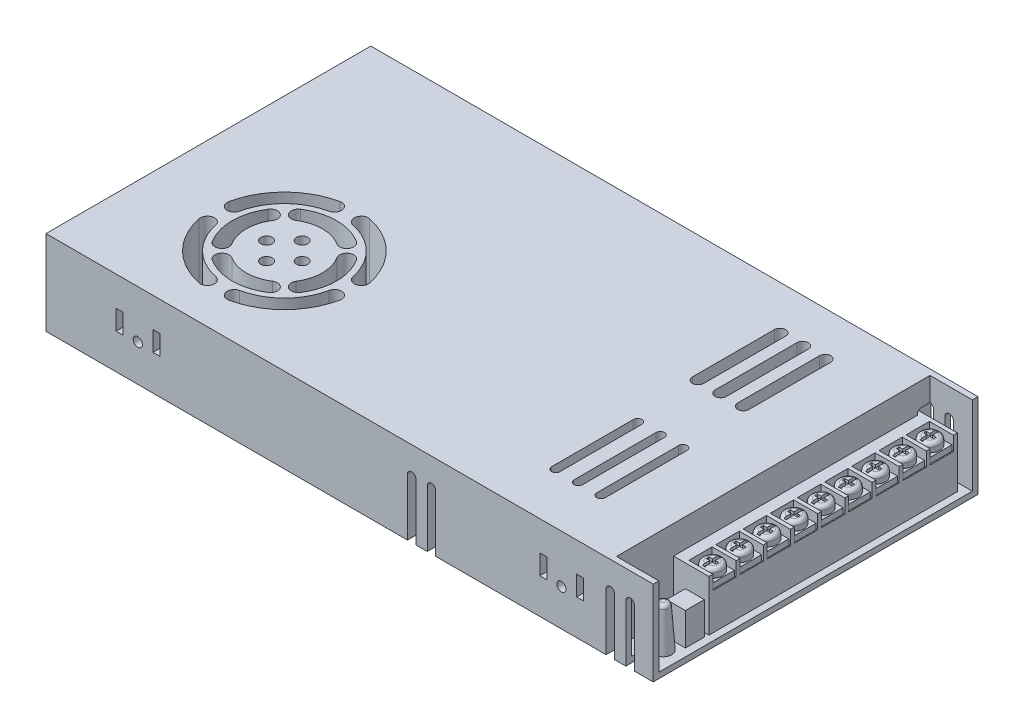
from build123d import *

# Parameters (mm, degrees)
CROQUIS1_W                         = 215
CROQUIS1_H                         = 115
SALIENTE_EXTRUIR1_DEPTH            = 30
CROQUIS2_W                         = 15
CROQUIS2_H                         = 111
CORTAR_EXTRUIR1_DEPTH              = 28
CROQUIS5_R                         = 1.625
CORTAR_EXTRUIR3_DEPTH              = 246.662369931
CORTAR_EXTRUIR5_DEPTH              = 28
CROQUIS10_W                        = 2.5
CROQUIS10_H                        = 7
CORTAR_EXTRUIR8_NO_CONFIRMAT_DEPTH = 246.662369931
CROQUIS11_W                        = 16
CROQUIS11_H                        = 88
SALIENTE_EXTRUIR2_DEPTH            = 20
CROQUIS12_W                        = 8.266666667
CROQUIS12_H                        = 5
CROQUIS12_W_2                      = 8.266666666
CORTAR_EXTRUIR11_DEPTH             = 8.5
CORTAR_EXTRUIR15_DEPTH             = 6.4
CUT_EXTRUDE2_START                 = -110
CUT_EXTRUDE2_DEPTH                 = 10
REDONDEO3_R                        = 1.3
CROQUIS18_R                        = 2
CORTAR_EXTRUIR17_DEPTH             = 28
CROQUIS28_R                        = 1.625
CORTAR_EXTRUIR23_DEPTH             = 2
CROQUIS29_R                        = 3.5
SALIENTE_EXTRUIR3_DEPTH            = 5
REDONDEO4_R                        = 1.3
CROQUIS30_W                        = 1
CROQUIS30_H                        = 6
CORTAR_EXTRUIR24_DEPTH             = 1
CROQUIS31_W                        = 3.5
CROQUIS31_H                        = 1
CORTAR_EXTRUIR25_DEPTH             = 1
CROQUIS32_W                        = 7.8
CROQUIS32_H                        = 7.8
SALIENTE_EXTRUIR4_DEPTH            = 2
MATRIZL1_COUNT                     = 9
MATRIZL1_PITCH                     = 9.62
CROQUIS34_W                        = 6.7
CROQUIS34_H                        = 6.7
SALIENTE_EXTRUIR5_DEPTH            = 11.5
CROQUIS35_R                        = 3
SALIENTE_EXTRUIR6_DEPTH            = 15
SALIENTE_EXTRUIR6_TAPER            = 4
REDONDEO5_R                        = 1.3


with BuildPart() as part:
    # Croquis1 → Saliente-Extruir1 (new body)
    with BuildSketch(Plane(origin=(0, 0, 0), x_dir=(1, 0, 0), z_dir=(0, 1, 0))):
        with Locations((107.5, 57.5)):
            Rectangle(CROQUIS1_W, CROQUIS1_H)
    extrude(amount=SALIENTE_EXTRUIR1_DEPTH)

    # Croquis2 → Cortar-Extruir1 (cut)
    with BuildSketch(Plane(origin=(0, 30, 0), x_dir=(1, 0, 0), z_dir=(0, 1, 0))):
        with Locations((207.5, 57.5)):
            Rectangle(CROQUIS2_W, CROQUIS2_H)
    extrude(amount=-CORTAR_EXTRUIR1_DEPTH, mode=Mode.SUBTRACT)

    # Croquis5 → Cortar-Extruir3 (cut, through all)
    with BuildSketch(Plane(origin=(0, 0, -115), x_dir=(-1, 0, 0), z_dir=(0, 0, -1))):
        with Locations((-182.5, 13)):
            Circle(CROQUIS5_R)
        with Locations((-32.5, 13)):
            Circle(CROQUIS5_R)
    extrude(amount=-CORTAR_EXTRUIR3_DEPTH, mode=Mode.SUBTRACT)

    # Croquis7 → Cortar-Extruir5 (cut)
    with BuildSketch(Plane(origin=(0, 30, 0), x_dir=(1, 0, 0), z_dir=(0, 1, 0))):
        with BuildLine():
            Line((178.4, 99.5), (178.4, 70.5))
            ThreePointArc((178.4, 70.5), (176.4, 68.5), (174.4, 70.5))
            Line((174.4, 70.5), (174.4, 99.5))
            ThreePointArc((174.4, 99.5), (176.4, 101.5), (178.4, 99.5))
        make_face()
        with BuildLine():
            Line((180, 47), (180, 18))
            ThreePointArc((180, 18), (178.5, 16.5), (177, 18))
            Line((177, 18), (177, 47))
            ThreePointArc((177, 47), (178.5, 48.5), (180, 47))
        make_face()
        with BuildLine():
            Line((170.4, 99.5), (170.4, 70.5))
            ThreePointArc((170.4, 70.5), (168.4, 68.5), (166.4, 70.5))
            Line((166.4, 70.5), (166.4, 99.5))
            ThreePointArc((166.4, 99.5), (168.4, 101.5), (170.4, 99.5))
        make_face()
        with BuildLine():
            Line((172, 47), (172, 18))
            ThreePointArc((172, 18), (170.5, 16.5), (169, 18))
            Line((169, 18), (169, 47))
            ThreePointArc((169, 47), (170.5, 48.5), (172, 47))
        make_face()
        with BuildLine():
            Line((162.4, 99.5), (162.4, 70.5))
            ThreePointArc((162.4, 70.5), (160.4, 68.5), (158.4, 70.5))
            Line((158.4, 70.5), (158.4, 99.5))
            ThreePointArc((158.4, 99.5), (160.4, 101.5), (162.4, 99.5))
        make_face()
        with BuildLine():
            Line((164, 47), (164, 18))
            ThreePointArc((164, 18), (162.5, 16.5), (161, 18))
            Line((161, 18), (161, 47))
            ThreePointArc((161, 47), (162.5, 48.5), (164, 47))
        make_face()
    extrude(amount=-CORTAR_EXTRUIR5_DEPTH, mode=Mode.SUBTRACT)

    # Croquis10 → Cortar-Extruir8 (no confirmat) (cut, through all)
    with BuildSketch(Plane(origin=(0, 0, -115), x_dir=(-1, 0, 0), z_dir=(0, 0, -1))):
        with Locations((-26.1, 16)):
            Rectangle(CROQUIS10_W, CROQUIS10_H)
        with Locations((-39.1, 16)):
            Rectangle(CROQUIS10_W, CROQUIS10_H)
        with Locations((-176.1, 16)):
            Rectangle(CROQUIS10_W, CROQUIS10_H)
        with Locations((-189.1, 16)):
            Rectangle(CROQUIS10_W, CROQUIS10_H)
    extrude(amount=-CORTAR_EXTRUIR8_NO_CONFIRMAT_DEPTH, mode=Mode.SUBTRACT)

    # Croquis17 → Cortar-Extruir15 (cut)
    with BuildSketch(Plane(origin=(0, 0, -115), x_dir=(-1, 0, 0), z_dir=(0, 0, -1))):
        with BuildLine():
            Line((-135, 20.2), (-135, 0))
            ThreePointArc((-135, 0), (-136.5, -1.5), (-138, 0))
            Line((-138, 0), (-138, 20.2))
            ThreePointArc((-138, 20.2), (-136.5, 21.7), (-135, 20.2))
        make_face()
        with BuildLine():
            Line((-128, 20.2), (-128, 0))
            ThreePointArc((-128, 0), (-129.5, -1.5), (-131, 0))
            Line((-131, 0), (-131, 20.2))
            ThreePointArc((-131, 20.2), (-129.5, 21.7), (-128, 20.2))
        make_face()
        with BuildLine():
            Line((-201.3, 0), (-201.3, 20.2))
            ThreePointArc((-201.3, 20.2), (-199.8, 21.7), (-198.3, 20.2))
            Line((-198.3, 20.2), (-198.3, 0))
            ThreePointArc((-198.3, 0), (-199.8, -1.5), (-201.3, 0))
        make_face()
        with BuildLine():
            Line((-208.3, 0), (-208.3, 20.2))
            ThreePointArc((-208.3, 20.2), (-206.8, 21.7), (-205.3, 20.2))
            Line((-205.3, 20.2), (-205.3, 0))
            ThreePointArc((-205.3, 0), (-206.8, -1.5), (-208.3, 0))
        make_face()
    extrude(amount=-CORTAR_EXTRUIR15_DEPTH, mode=Mode.SUBTRACT)

    # Croquis17<2> → Cut-Extrude2 (cut)
    with BuildSketch(Plane(origin=(0, 0, -115), x_dir=(-1, 0, 0), z_dir=(0, 0, -1)).offset(CUT_EXTRUDE2_START)):
        with BuildLine():
            Line((-135, 20.2), (-135, 0))
            ThreePointArc((-135, 0), (-136.5, -1.5), (-138, 0))
            Line((-138, 0), (-138, 20.2))
            ThreePointArc((-138, 20.2), (-136.5, 21.7), (-135, 20.2))
        make_face()
        with BuildLine():
            Line((-128, 20.2), (-128, 0))
            ThreePointArc((-128, 0), (-129.5, -1.5), (-131, 0))
            Line((-131, 0), (-131, 20.2))
            ThreePointArc((-131, 20.2), (-129.5, 21.7), (-128, 20.2))
        make_face()
        with BuildLine():
            Line((-201.3, 0), (-201.3, 20.2))
            ThreePointArc((-201.3, 20.2), (-199.8, 21.7), (-198.3, 20.2))
            Line((-198.3, 20.2), (-198.3, 0))
            ThreePointArc((-198.3, 0), (-199.8, -1.5), (-201.3, 0))
        make_face()
        with BuildLine():
            Line((-208.3, 0), (-208.3, 20.2))
            ThreePointArc((-208.3, 20.2), (-206.8, 21.7), (-205.3, 20.2))
            Line((-205.3, 20.2), (-205.3, 0))
            ThreePointArc((-205.3, 0), (-206.8, -1.5), (-208.3, 0))
        make_face()
    extrude(amount=-CUT_EXTRUDE2_DEPTH, mode=Mode.SUBTRACT)

    # Redondeo3
    redondeo3_edges = [part.edges().sort_by_distance(p)[0] for p in [
        (136.5, 21.7, -108.6),
        (135, 10.1, -108.6),
        (138, 10.1, -108.6),
        (129.5, 21.7, -108.6),
        (128, 10.1, -108.6),
        (131, 10.1, -108.6),
        (201.3, 1, -108.6),
        (198.812579117, 21.329158979, -108.6),
        (198.3, 10.1, -108.6),
        (208.3, 1, -108.6),
        (205.3, 1, -108.6),
        (135, 10.1, -5),
        (136.5, 21.7, -5),
        (138, 10.1, -5),
        (128, 10.1, -5),
        (129.5, 21.7, -5),
        (131, 10.1, -5),
        (198.3, 10.1, -5),
        (198.812579117, 21.329158979, -5),
        (201.3, 1, -5),
        (205.3, 1, -5),
        (208.3, 1, -5),
    ]]
    fillet(redondeo3_edges, radius=REDONDEO3_R - 0.0001)  # a hair under: the kernel refuses the full size

    # Croquis18 → Cortar-Extruir17 (cut)
    with BuildSketch(Plane(origin=(0, 30, 0), x_dir=(1, 0, 0), z_dir=(0, 1, 0))):
        with Locations(Location((41.2, 36.9, 0), (0, 0, 270))):
            Circle(CROQUIS18_R)
        with Locations(Location((47.5, 43.2, 0), (0, 0, 270))):
            Circle(CROQUIS18_R)
        with Locations(Location((53.8, 36.9, 0), (0, 0, 270))):
            Circle(CROQUIS18_R)
        with Locations(Location((47.5, 30.6, 0), (0, 0, 270))):
            Circle(CROQUIS18_R)
        with BuildLine():
            ThreePointArc((42.233695652, 61.850271311), (29.46877708, 54.93122292), (22.549728689, 42.166304348))
            ThreePointArc((22.549728689, 42.166304348), (24.479529404, 39.203894963), (27.441938763, 41.133695717))
            ThreePointArc((27.441938763, 41.133695717), (33.004311009, 51.395689038), (43.266304348, 56.95806125))
            ThreePointArc((43.266304348, 56.95806125), (45.196105031, 59.920470629), (42.233695652, 61.850271311))
        make_face()
        with BuildLine():
            ThreePointArc((67.55806125, 41.133695652), (61.995689038, 51.395688991), (51.733695717, 56.958061237))
            ThreePointArc((51.733695717, 56.958061237), (49.803894963, 59.920470596), (52.766304348, 61.850271311))
            ThreePointArc((52.766304348, 61.850271311), (65.53122292, 54.93122292), (72.450271311, 42.166304348))
            ThreePointArc((72.450271311, 42.166304348), (70.520470629, 39.203894969), (67.55806125, 41.133695652))
        make_face()
        with BuildLine():
            ThreePointArc((51.733695652, 16.84193875), (61.995688991, 22.404310962), (67.558061237, 32.666304283))
            ThreePointArc((67.558061237, 32.666304283), (70.520470596, 34.596105037), (72.450271311, 31.633695652))
            ThreePointArc((72.450271311, 31.633695652), (65.53122292, 18.86877708), (52.766304348, 11.949728689))
            ThreePointArc((52.766304348, 11.949728689), (49.803894969, 13.879529371), (51.733695652, 16.84193875))
        make_face()
        with BuildLine():
            ThreePointArc((27.44193875, 32.666304348), (33.004310962, 22.404311009), (43.266304283, 16.841938763))
            ThreePointArc((43.266304283, 16.841938763), (45.196105037, 13.879529404), (42.233695652, 11.949728689))
            ThreePointArc((42.233695652, 11.949728689), (29.46877708, 18.86877708), (22.549728689, 31.633695652))
            ThreePointArc((22.549728689, 31.633695652), (24.479529371, 34.596105031), (27.44193875, 32.666304348))
        make_face()
        with BuildLine():
            ThreePointArc((31.873772868, 46.803081622), (29, 36.9), (31.873772868, 26.996918378))
            ThreePointArc((31.873772868, 26.996918378), (35.323679456, 26.223520336), (36.097077498, 29.673426924))
            ThreePointArc((36.097077498, 29.673426924), (34, 36.9), (36.097077498, 44.126573076))
            ThreePointArc((36.097077498, 44.126573076), (35.323679456, 47.576479664), (31.873772868, 46.803081622))
        make_face()
        with BuildLine():
            ThreePointArc((57.403081622, 52.526227132), (47.5, 55.4), (37.596918378, 52.526227132))
            ThreePointArc((37.596918378, 52.526227132), (36.823520336, 49.076320544), (40.273426924, 48.302922502))
            ThreePointArc((40.273426924, 48.302922502), (47.5, 50.4), (54.726573076, 48.302922502))
            ThreePointArc((54.726573076, 48.302922502), (58.176479664, 49.076320544), (57.403081622, 52.526227132))
        make_face()
        with BuildLine():
            ThreePointArc((63.126227132, 26.996918378), (66, 36.9), (63.126227132, 46.803081622))
            ThreePointArc((63.126227132, 46.803081622), (59.676320544, 47.576479664), (58.902922502, 44.126573076))
            ThreePointArc((58.902922502, 44.126573076), (61, 36.9), (58.902922502, 29.673426924))
            ThreePointArc((58.902922502, 29.673426924), (59.676320544, 26.223520336), (63.126227132, 26.996918378))
        make_face()
        with BuildLine():
            ThreePointArc((37.596918378, 21.273772868), (47.5, 18.4), (57.403081622, 21.273772868))
            ThreePointArc((57.403081622, 21.273772868), (58.176479664, 24.723679456), (54.726573076, 25.497077498))
            ThreePointArc((54.726573076, 25.497077498), (47.5, 23.4), (40.273426924, 25.497077498))
            ThreePointArc((40.273426924, 25.497077498), (36.823520336, 24.723679456), (37.596918378, 21.273772868))
        make_face()
    extrude(amount=-CORTAR_EXTRUIR17_DEPTH, mode=Mode.SUBTRACT)

    # Croquis28 → Cortar-Extruir23 (cut)
    with BuildSketch(Plane.XZ):
        with Locations(Location((32.5, -32.5, 0), (0, 0, 270))):
            Circle(CROQUIS28_R)
        with Locations(Location((32.5, -82.5, 0), (0, 0, 270))):
            Circle(CROQUIS28_R)
        with Locations(Location((182.5, -32.5, 0), (0, 0, 270))):
            Circle(CROQUIS28_R)
        with Locations(Location((182.5, -82.5, 0), (0, 0, 270))):
            Circle(CROQUIS28_R)
    extrude(amount=-CORTAR_EXTRUIR23_DEPTH, mode=Mode.SUBTRACT)


with BuildPart() as body_2:
    # Croquis11 → Saliente-Extruir2 (new body)
    with BuildSketch(Plane(origin=(0, 0, 0), x_dir=(1, 0, 0), z_dir=(0, 1, 0))):
        with Locations((204.5, 66.2)):
            Rectangle(CROQUIS11_W, CROQUIS11_H)
    extrude(amount=SALIENTE_EXTRUIR2_DEPTH)

    # Croquis12 → Cortar-Extruir11 (cut)
    with BuildSketch(Plane(origin=(212.5, 0, 0), x_dir=(0, 0, -1), z_dir=(1, 0, 0))):
        with Locations((27.733333333, 17.5)):
            Rectangle(CROQUIS12_W, CROQUIS12_H)
        with Locations((37.35, 17.5)):
            Rectangle(CROQUIS12_W_2, CROQUIS12_H)
        with Locations((46.966666667, 17.5)):
            Rectangle(CROQUIS12_W, CROQUIS12_H)
        with Locations((56.583333334, 17.5)):
            Rectangle(CROQUIS12_W, CROQUIS12_H)
        with Locations((66.2, 17.5)):
            Rectangle(CROQUIS12_W_2, CROQUIS12_H)
        with Locations((75.816666666, 17.5)):
            Rectangle(CROQUIS12_W, CROQUIS12_H)
        with Locations((85.433333334, 17.5)):
            Rectangle(CROQUIS12_W, CROQUIS12_H)
        with Locations((95.05, 17.5)):
            Rectangle(CROQUIS12_W_2, CROQUIS12_H)
        with Locations((104.666666667, 17.5)):
            Rectangle(CROQUIS12_W, CROQUIS12_H)
    extrude(amount=-CORTAR_EXTRUIR11_DEPTH, mode=Mode.SUBTRACT)


with BuildPart() as body_3:
    # Croquis29 → Saliente-Extruir3 (new body)
    with BuildSketch(Plane(origin=(0, 15, 0), x_dir=(1, 0, 0), z_dir=(0, 1, 0))):
        with Locations(Location((208.25, 27.733333333, 0), (0, 0, 270))):
            Circle(CROQUIS29_R)
    extrude(amount=SALIENTE_EXTRUIR3_DEPTH)

    # Redondeo4
    redondeo4_edges = [body_3.edges().sort_by_distance(p)[0] for p in [
        (208.25, 20, -31.233333333),
    ]]
    fillet(redondeo4_edges, radius=REDONDEO4_R)

    # Croquis30 → Cortar-Extruir24 (cut)
    with BuildSketch(Plane(origin=(0, 20, 0), x_dir=(1, 0, 0), z_dir=(0, 1, 0))):
        with Locations((208.25, 27.733333333)):
            Rectangle(CROQUIS30_W, CROQUIS30_H)
    extrude(amount=-CORTAR_EXTRUIR24_DEPTH, mode=Mode.SUBTRACT)

    # Croquis31 → Cortar-Extruir25 (cut)
    with BuildSketch(Plane(origin=(0, 20, 0), x_dir=(1, 0, 0), z_dir=(0, 1, 0))):
        with Locations((208.25, 27.733333333)):
            Rectangle(CROQUIS31_W, CROQUIS31_H)
    extrude(amount=-CORTAR_EXTRUIR25_DEPTH, mode=Mode.SUBTRACT)

    # Croquis32 → Saliente-Extruir4 (add)
    with BuildSketch(Plane(origin=(0, 15, 0), x_dir=(1, 0, 0), z_dir=(0, 1, 0))):
        with Locations((208.25, 27.733333333)):
            Rectangle(CROQUIS32_W, CROQUIS32_H)
    extrude(amount=SALIENTE_EXTRUIR4_DEPTH)


with BuildPart() as matrizl1_1:
    # MatrizL1: pattern copy
    add(body_3.part.moved(Location(Vector(0, 0, -1) * (1 * MATRIZL1_PITCH))))


with BuildPart() as matrizl1_2:
    # MatrizL1: pattern copy
    add(body_3.part.moved(Location(Vector(0, 0, -1) * (2 * MATRIZL1_PITCH))))


with BuildPart() as matrizl1_3:
    # MatrizL1: pattern copy
    add(body_3.part.moved(Location(Vector(0, 0, -1) * (3 * MATRIZL1_PITCH))))


with BuildPart() as matrizl1_4:
    # MatrizL1: pattern copy
    add(body_3.part.moved(Location(Vector(0, 0, -1) * (4 * MATRIZL1_PITCH))))


with BuildPart() as matrizl1_5:
    # MatrizL1: pattern copy
    add(body_3.part.moved(Location(Vector(0, 0, -1) * (5 * MATRIZL1_PITCH))))


with BuildPart() as matrizl1_6:
    # MatrizL1: pattern copy
    add(body_3.part.moved(Location(Vector(0, 0, -1) * (6 * MATRIZL1_PITCH))))


with BuildPart() as matrizl1_7:
    # MatrizL1: pattern copy
    add(body_3.part.moved(Location(Vector(0, 0, -1) * (7 * MATRIZL1_PITCH))))


with BuildPart() as matrizl1_8:
    # MatrizL1: pattern copy
    add(body_3.part.moved(Location(Vector(0, 0, -1) * (8 * MATRIZL1_PITCH))))


with BuildPart() as body_12:
    # Croquis34 → Saliente-Extruir5 (new body)
    with BuildSketch(Plane(origin=(0, 2, 0), x_dir=(1, 0, 0), z_dir=(0, 1, 0))):
        with Locations((208.95, 17.45)):
            Rectangle(CROQUIS34_W, CROQUIS34_H)
    extrude(amount=SALIENTE_EXTRUIR5_DEPTH)


with BuildPart() as body_13:
    # Croquis35 → Saliente-Extruir6 (new body)
    with BuildSketch(Plane(origin=(0, 2, 0), x_dir=(1, 0, 0), z_dir=(0, 1, 0))):
        with Locations((208.95, 9.6)):
            Circle(CROQUIS35_R)
    extrude(amount=SALIENTE_EXTRUIR6_DEPTH, taper=SALIENTE_EXTRUIR6_TAPER)

    # Redondeo5
    redondeo5_edges = [body_13.edges().sort_by_distance(p)[0] for p in [
        (206.998902179, 17, -9.6),
    ]]
    fillet(redondeo5_edges, radius=REDONDEO5_R)


solid = Compound([part.part, body_2.part, body_3.part, matrizl1_1.part, matrizl1_2.part, matrizl1_3.part, matrizl1_4.part, matrizl1_5.part, matrizl1_6.part, matrizl1_7.part, matrizl1_8.part, body_12.part, body_13.part])
